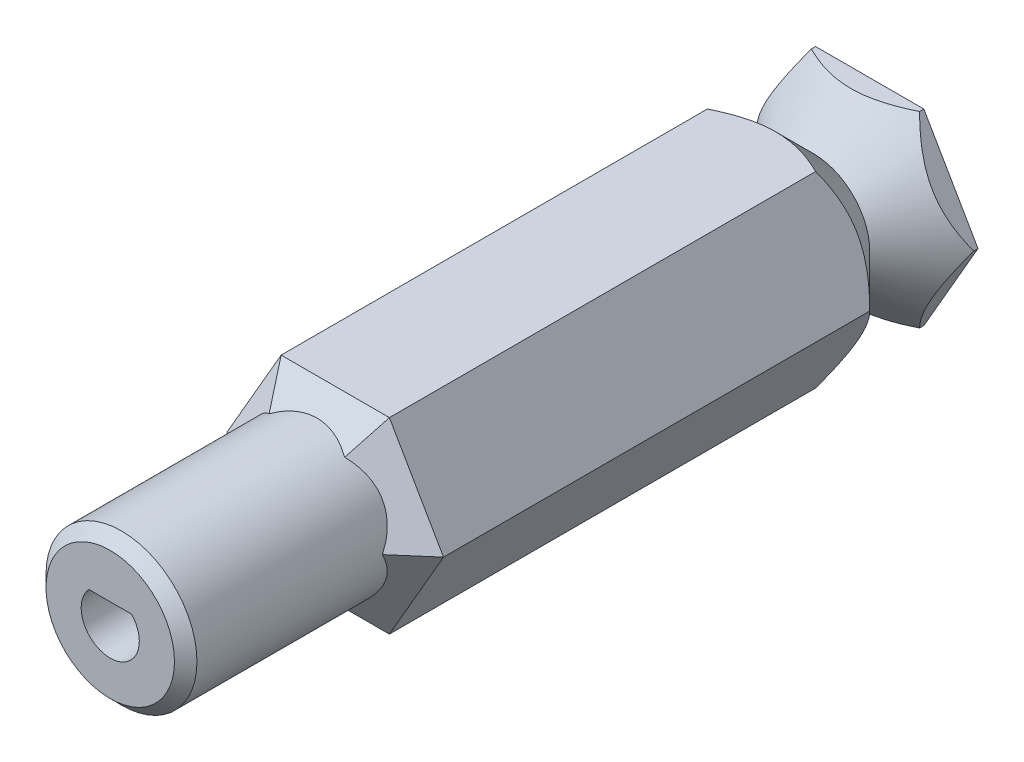
from build123d import *

# Parameters (mm, degrees)
EXTRUDE_1_DEPTH     = 30
SKETCH_2_R          = 4.025
EXTRUDE_2_DEPTH     = 10.5
CHAMFER_1_SIZE      = 0.6
CUT_EXTRUDE_1_DEPTH = 8
CHAMFER_2_SIZE      = 1.5


with BuildPart() as part:
    # 草图1 → 凸台-拉伸1 (new body)
    with BuildSketch(Plane.XY):
        Polygon((5.773502692, 0), (2.886751346, 5), (-2.886751346, 5), (-5.773502692, 0), (-2.886751346, -5), (2.886751346, -5), align=None)
    extrude(amount=EXTRUDE_1_DEPTH)

    # 草图2 → 凸台-拉伸2 (add)
    with BuildSketch(Plane.XY.offset(30)):
        with Locations(Location((0, 0, 0), (0, 0, 180))):
            Circle(SKETCH_2_R)
    extrude(amount=EXTRUDE_2_DEPTH)

    # 倒角1
    chamfer_1_edges = [part.edges().sort_by_distance(p)[0] for p in [
        (4.025, 0, 40.5),
    ]]
    chamfer(chamfer_1_edges, length=CHAMFER_1_SIZE)

    # 草图3 → 切除-拉伸1 (cut)
    with BuildSketch(Plane.XY.offset(40.5)):
        with BuildLine():
            Line((-1.140175425, 1.05), (1.140175425, 1.05))
            ThreePointArc((1.140175425, 1.05), (0, -1.55), (-1.140175425, 1.05))
        make_face()
    extrude(amount=-CUT_EXTRUDE_1_DEPTH, mode=Mode.SUBTRACT)

    # 倒角2
    # the kernel refuses this chamfer: 1.5 mm, written as the material it takes off along each edge
    with BuildSketch(Plane(origin=(6.744275828, 5, 30), x_dir=(3.229355886475551e-15, -0.9996219169112968, 0.027495876610586775), z_dir=(-1, 0, 0))) as chamfer_2_piece_1_section:
        Polygon((CHAMFER_2_SIZE * 0.999621916911, -CHAMFER_2_SIZE * 0.0274958766106), (-CHAMFER_2_SIZE * 0.0274958766106, -CHAMFER_2_SIZE * 0.999621916911), (0, 0), align=None)
    chamfer_2_piece_1 = extrude(amount=13.488551656, mode=Mode.PRIVATE)
    chamfer_2_piece_1 = chamfer_2_piece_1 - Plane(origin=(0, 0, 29.496283425), x_dir=(-1, 0, 0), z_dir=(0, 0, -1)) * Cylinder(4.025, 33, mode=Mode.PRIVATE)
    add(chamfer_2_piece_1, mode=Mode.SUBTRACT)
    with BuildSketch(Plane(origin=(-0.957989105, 8.340714197, 30), x_dir=(0.865697974224883, -0.49981095845564333, 0.02749587661058677), z_dir=(-0.49999999999999506, -0.8660254037844416, 0))) as chamfer_2_piece_2_section:
        Polygon((CHAMFER_2_SIZE * 0.999621916911, -CHAMFER_2_SIZE * 0.0274958766106), (-CHAMFER_2_SIZE * 0.0274958766106, -CHAMFER_2_SIZE * 0.999621916911), (0, 0), align=None)
    chamfer_2_piece_2 = extrude(amount=13.488551656, mode=Mode.PRIVATE)
    chamfer_2_piece_2 = chamfer_2_piece_2 - Plane(origin=(0, 0, 29.496283425), x_dir=(-1, 0, 0), z_dir=(0, 0, -1)) * Cylinder(4.025, 33, mode=Mode.PRIVATE)
    add(chamfer_2_piece_2, mode=Mode.SUBTRACT)
    with BuildSketch(Plane(origin=(-7.702264933, 3.340714197, 30), x_dir=(0.8656979742248763, 0.49981095845565543, 0.02749587661058678), z_dir=(0.5000000000000071, -0.8660254037844346, 0))) as chamfer_2_piece_3_section:
        Polygon((CHAMFER_2_SIZE * 0.999621916911, -CHAMFER_2_SIZE * 0.0274958766106), (-CHAMFER_2_SIZE * 0.0274958766106, -CHAMFER_2_SIZE * 0.999621916911), (0, 0), align=None)
    chamfer_2_piece_3 = extrude(amount=13.488551656, mode=Mode.PRIVATE)
    chamfer_2_piece_3 = chamfer_2_piece_3 - Plane(origin=(0, 0, 29.496283426), x_dir=(-1, 0, 0), z_dir=(0, 0, -1)) * Cylinder(4.025, 33, mode=Mode.PRIVATE)
    add(chamfer_2_piece_3, mode=Mode.SUBTRACT)
    with BuildSketch(Plane(origin=(-6.744275828, -5, 30), x_dir=(-1.061074076984824e-14, 0.9996219169112968, 0.027495876610586775), z_dir=(1, 0, 0))) as chamfer_2_piece_4_section:
        Polygon((CHAMFER_2_SIZE * 0.999621916911, -CHAMFER_2_SIZE * 0.0274958766106), (-CHAMFER_2_SIZE * 0.0274958766106, -CHAMFER_2_SIZE * 0.999621916911), (0, 0), align=None)
    chamfer_2_piece_4 = extrude(amount=13.488551656, mode=Mode.PRIVATE)
    chamfer_2_piece_4 = chamfer_2_piece_4 - Plane(origin=(0, 0, 29.496283425), x_dir=(-1, 0, 0), z_dir=(0, 0, -1)) * Cylinder(4.025, 33, mode=Mode.PRIVATE)
    add(chamfer_2_piece_4, mode=Mode.SUBTRACT)
    with BuildSketch(Plane(origin=(0.957989105, -8.340714197, 30), x_dir=(-0.865697974224883, 0.49981095845564333, 0.02749587661058677), z_dir=(0.49999999999999506, 0.8660254037844416, 0))) as chamfer_2_piece_5_section:
        Polygon((CHAMFER_2_SIZE * 0.999621916911, -CHAMFER_2_SIZE * 0.0274958766106), (-CHAMFER_2_SIZE * 0.0274958766106, -CHAMFER_2_SIZE * 0.999621916911), (0, 0), align=None)
    chamfer_2_piece_5 = extrude(amount=13.488551656, mode=Mode.PRIVATE)
    chamfer_2_piece_5 = chamfer_2_piece_5 - Plane(origin=(0, 0, 29.496283425), x_dir=(-1, 0, 0), z_dir=(0, 0, -1)) * Cylinder(4.025, 33, mode=Mode.PRIVATE)
    add(chamfer_2_piece_5, mode=Mode.SUBTRACT)
    with BuildSketch(Plane(origin=(7.702264933, -3.340714197, 30), x_dir=(-0.8656979742248796, -0.4998109584556494, 0.02749587661058677), z_dir=(-0.5000000000000011, 0.866025403784438, 0))) as chamfer_2_piece_6_section:
        Polygon((CHAMFER_2_SIZE * 0.999621916911, -CHAMFER_2_SIZE * 0.0274958766106), (-CHAMFER_2_SIZE * 0.0274958766106, -CHAMFER_2_SIZE * 0.999621916911), (0, 0), align=None)
    chamfer_2_piece_6 = extrude(amount=13.488551656, mode=Mode.PRIVATE)
    chamfer_2_piece_6 = chamfer_2_piece_6 - Plane(origin=(0, 0, 29.496283425), x_dir=(-1, 0, 0), z_dir=(0, 0, -1)) * Cylinder(4.025, 33, mode=Mode.PRIVATE)
    add(chamfer_2_piece_6, mode=Mode.SUBTRACT)

    # 草图4 → 切除-旋转4 (revolve, cut)
    with BuildSketch(Plane(origin=(0, 0, 0), x_dir=(0, 0, -1), z_dir=(1, 0, 0)), mode=Mode.PRIVATE) as cut_revolve_4_sk:
        Polygon((-6.5, 6.5), (0.5, 6.5), (-3, 3), align=None)
    revolve(cut_revolve_4_sk.sketch.rotate(Axis((0, 0, -6.39558723), (0, 0, 1)), 89.591845794), axis=Axis((0, 0, -6.39558723), (0, 0, 1)), mode=Mode.SUBTRACT)


solid = part.part
